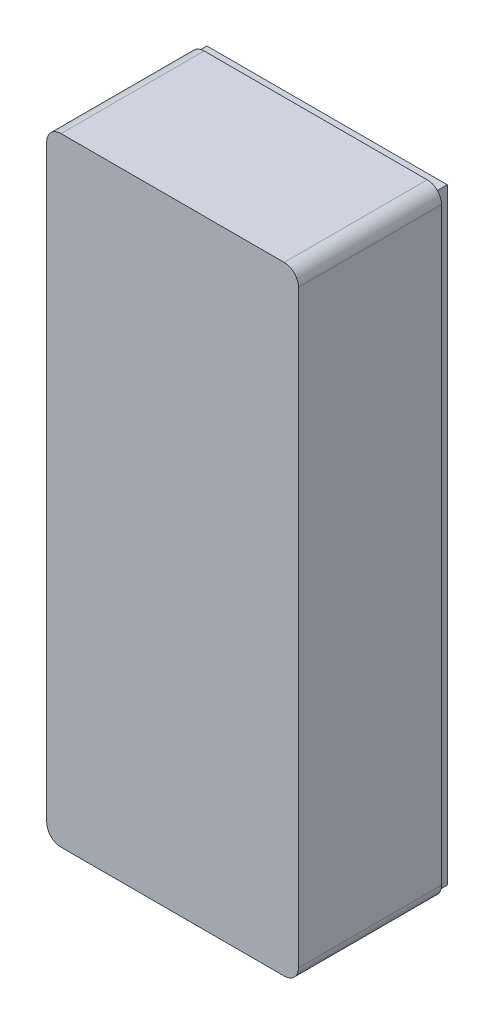
from build123d import *

# Parameters (mm, degrees)
SKICA1_W                 = 44
SKICA1_H                 = 108
SKICA1_W_2               = 40
SKICA1_H_2               = 104
P_IDAT_VYSUNUT_M1_DEPTH  = 25
SKICA2_W                 = 44
SKICA2_H                 = 108
P_IDAT_VYSUNUT_M2_DEPTH  = 2
ZAOBLIT1_R               = 2.5
SKICA3_W                 = 44
SKICA3_H                 = 108
SKICA3_W_2               = 42
SKICA3_H_2               = 106
ODEBRAT_VYSUNUT_M1_DEPTH = 2
SKICA4_R                 = 1.5
P_IDAT_VYSUNUT_M3_DEPTH  = 22
ODEBRAT_VYSUNUT_M2_DEPTH = 10
SKICA7_W                 = 40
SKICA7_H                 = 2
SKICA7_W_2               = 5
P_IDAT_VYSUNUT_M4_DEPTH  = 10


with BuildPart() as part:
    # Skica1 → Přidat vysunutím1 (new body)
    with BuildSketch(Plane.XY):
        with Locations((22, 54)):
            Rectangle(SKICA1_W, SKICA1_H)
        with Locations((22, 54)):
            Rectangle(SKICA1_W_2, SKICA1_H_2, mode=Mode.SUBTRACT)
    extrude(amount=P_IDAT_VYSUNUT_M1_DEPTH)

    # Skica2 → Přidat vysunutím2 (add)
    with BuildSketch(Plane.XY.offset(25)):
        with Locations((22, 54)):
            Rectangle(SKICA2_W, SKICA2_H)
    extrude(amount=P_IDAT_VYSUNUT_M2_DEPTH)

    # Zaoblit1
    zaoblit1_edges = [part.edges().sort_by_distance(p)[0] for p in [
        (0, 108, 13.5),
        (0, 0, 13.5),
        (44, 0, 13.5),
        (44, 108, 13.5),
    ]]
    fillet(zaoblit1_edges, radius=ZAOBLIT1_R)

    # Skica3 → Odebrat vysunutím1 (cut)
    with BuildSketch(Plane(origin=(0, 0, 0), x_dir=(-1, 0, 0), z_dir=(0, 0, -1))):
        with Locations((-22, 54)):
            Rectangle(SKICA3_W, SKICA3_H)
        with Locations((-22, 54)):
            Rectangle(SKICA3_W_2, SKICA3_H_2, mode=Mode.SUBTRACT)
    extrude(amount=-ODEBRAT_VYSUNUT_M1_DEPTH, mode=Mode.SUBTRACT)

    # Skica4 → Přidat vysunutím3 (add)
    # profile 1 of 4: a face of its own
    with BuildSketch(Plane(origin=(0, 0, 25), x_dir=(-1, 0, 0), z_dir=(0, 0, -1))):
        with BuildLine():
            Line((-42, 2), (-42, 10))
            ThreePointArc((-42, 10), (-36.343145751, 7.656854249), (-34, 2))
            Line((-34, 2), (-42, 2))
        make_face()
        with Locations((-39, 5)):
            Circle(SKICA4_R, mode=Mode.SUBTRACT)
    # profile 2 of 4: a face of its own
    with BuildSketch(Plane(origin=(0, 0, 25), x_dir=(-1, 0, 0), z_dir=(0, 0, -1))):
        with BuildLine():
            Line((-2, 2), (-10, 2))
            ThreePointArc((-10, 2), (-7.656854249, 7.656854249), (-2, 10))
            Line((-2, 10), (-2, 2))
        make_face()
        with Locations((-5, 5)):
            Circle(SKICA4_R, mode=Mode.SUBTRACT)
    # profile 3 of 4: a face of its own
    with BuildSketch(Plane(origin=(0, 0, 25), x_dir=(-1, 0, 0), z_dir=(0, 0, -1))):
        with BuildLine():
            Line((-2, 80), (-2, 76))
            Line((-2, 76), (-5, 76))
            ThreePointArc((-5, 76), (-9, 80), (-5, 84))
            Line((-5, 84), (-2, 84))
            Line((-2, 84), (-2, 80))
        make_face()
        with Locations((-5, 80)):
            Circle(SKICA4_R, mode=Mode.SUBTRACT)
    # profile 4 of 4: a face of its own
    with BuildSketch(Plane(origin=(0, 0, 25), x_dir=(-1, 0, 0), z_dir=(0, 0, -1))):
        with BuildLine():
            Line((-42, 84), (-39, 84))
            ThreePointArc((-39, 84), (-35, 80), (-39, 76))
            Line((-39, 76), (-42, 76))
            Line((-42, 76), (-42, 84))
        make_face()
        with Locations((-39, 80)):
            Circle(SKICA4_R, mode=Mode.SUBTRACT)
    extrude(amount=P_IDAT_VYSUNUT_M3_DEPTH)

    # Skica6 → Odebrat vysunutím2 (cut)
    with BuildSketch(Plane.XZ):
        Polygon((22, 10.4), (15.25, 10.4), (15.25, 5), (28.75, 5), (28.75, 10.4), align=None)
    extrude(amount=-ODEBRAT_VYSUNUT_M2_DEPTH, mode=Mode.SUBTRACT)

    # Skica7 → Přidat vysunutím4 (add)
    with BuildSketch(Plane(origin=(0, 0, 25), x_dir=(-1, 0, 0), z_dir=(0, 0, -1))):
        with Locations((-22, 15)):
            Rectangle(SKICA7_W, SKICA7_H)
        with Locations((-39.5, 64.682971934)):
            Rectangle(SKICA7_W_2, SKICA7_H)
    extrude(amount=P_IDAT_VYSUNUT_M4_DEPTH)


solid = part.part
